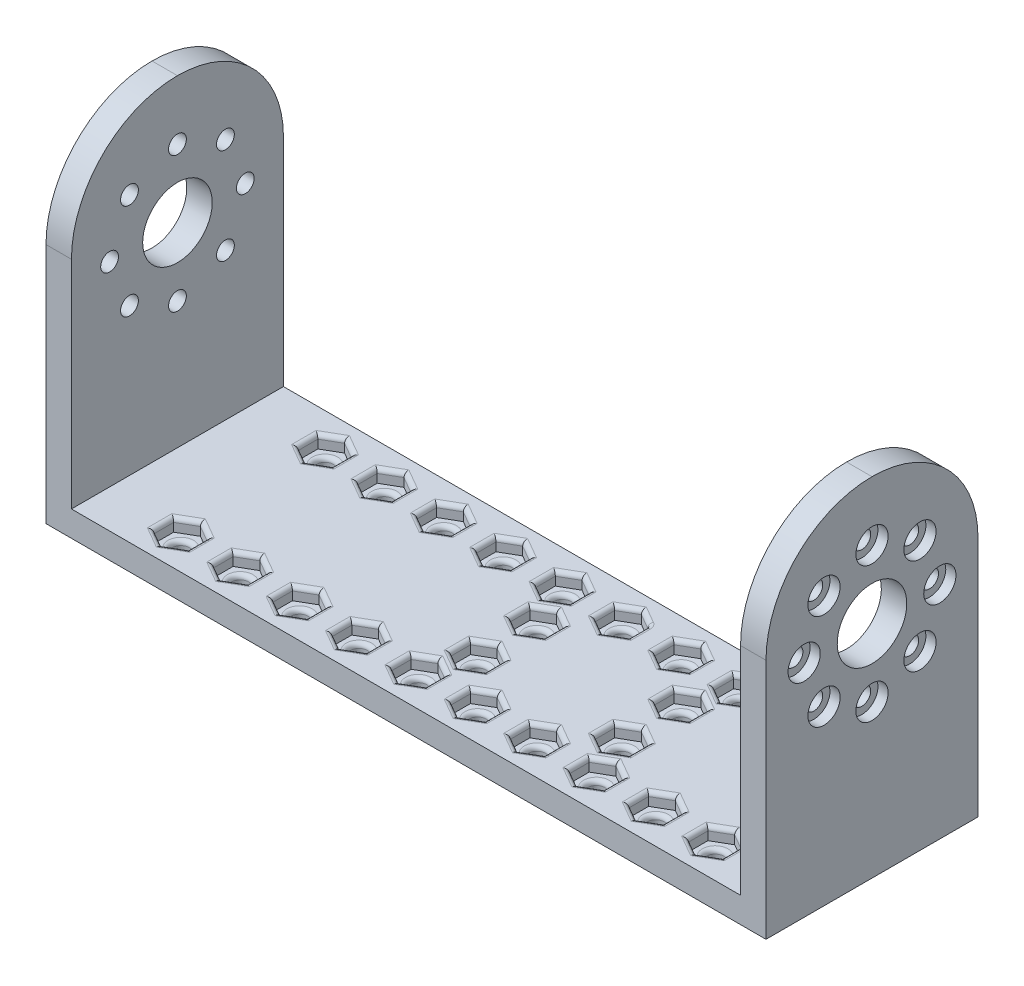
from build123d import *

# Parameters (mm, degrees)
BOSS_EXTRUDE1_DEPTH      = 25
SKETCH2_R                = 4.1
CUT_EXTRUDE1_DEPTH       = 3
SKETCH3_R                = 1.05
CUT_EXTRUDE2_DEPTH       = 81.9
SKETCH4_R                = 1.9
CUT_EXTRUDE3_DEPTH       = 1.2
CIRPATTERN1_COUNT        = 8
MIRROR2_COPY_1_SKETCH_R  = 1.05
MIRROR2_COPY_1_DEPTH     = 81.9
MIRROR2_COPY_2_SKETCH_R  = 1.05
MIRROR2_COPY_2_DEPTH     = 81.9
MIRROR2_COPY_3_SKETCH_R  = 1.05
MIRROR2_COPY_3_DEPTH     = 81.9
MIRROR2_COPY_4_SKETCH_R  = 1.05
MIRROR2_COPY_4_DEPTH     = 81.9
MIRROR2_COPY_5_SKETCH_R  = 1.05
MIRROR2_COPY_5_DEPTH     = 81.9
MIRROR2_COPY_6_SKETCH_R  = 1.05
MIRROR2_COPY_6_DEPTH     = 81.9
MIRROR2_COPY_7_SKETCH_R  = 1.05
MIRROR2_COPY_7_DEPTH     = 81.9
MIRROR2_COPY_8_SKETCH_R  = 1.9
MIRROR2_COPY_8_DEPTH     = 1.2
MIRROR2_COPY_9_SKETCH_R  = 1.9
MIRROR2_COPY_9_DEPTH     = 1.2
MIRROR2_COPY_10_SKETCH_R = 1.9
MIRROR2_COPY_10_DEPTH    = 1.2
MIRROR2_COPY_11_SKETCH_R = 1.9
MIRROR2_COPY_11_DEPTH    = 1.2
MIRROR2_COPY_12_SKETCH_R = 1.9
MIRROR2_COPY_12_DEPTH    = 1.2
MIRROR2_COPY_13_SKETCH_R = 1.9
MIRROR2_COPY_13_DEPTH    = 1.2
MIRROR2_COPY_14_SKETCH_R = 1.9
MIRROR2_COPY_14_DEPTH    = 1.2
CONG_1_R                 = 12.5
ESQUISSE1_R              = 1
ENL_V_MAT_EXTRU_1_DEPTH  = 10
CUT_EXTRUDE4_DEPTH       = 1.5
FILLET1_R                = 0.5


with BuildPart() as part:
    # Sketch1 → Boss-Extrude1 (new body)
    with BuildSketch(Plane.XY):
        Polygon((0, 0), (-42.45, 0), (-42.45, 41), (-39.45, 41), (-39.45, 3), (0, 3), align=None)
    boss_extrude1 = extrude(amount=BOSS_EXTRUDE1_DEPTH)

    # Sketch2 → Cut-Extrude1 (cut)
    with BuildSketch(Plane.ZY.offset(42.45)):
        with Locations((12.5, 26)):
            Circle(SKETCH2_R)
    cut_extrude1 = extrude(amount=-CUT_EXTRUDE1_DEPTH, mode=Mode.SUBTRACT)

    # Sketch3 → Cut-Extrude2 (cut)
    with BuildSketch(Plane.ZY.offset(42.45)):
        with Locations((12.5, 34)):
            Circle(SKETCH3_R)
    cut_extrude2 = extrude(amount=-CUT_EXTRUDE2_DEPTH, mode=Mode.SUBTRACT)

    # Sketch4 → Cut-Extrude3 (cut)
    with BuildSketch(Plane.ZY.offset(42.45)):
        with Locations((12.5, 34)):
            Circle(SKETCH4_R)
    cut_extrude3 = extrude(amount=-CUT_EXTRUDE3_DEPTH, mode=Mode.SUBTRACT)

    # CirPattern1: Cut-Extrude2, Cut-Extrude3 ×8 about axis
    cirpattern1_axis = Axis((0, 26, 12.5), (1, 0, 0))
    add([cut_extrude2.rotate(cirpattern1_axis, i * 360 / CIRPATTERN1_COUNT) for i in range(1, CIRPATTERN1_COUNT)], mode=Mode.SUBTRACT)
    add([cut_extrude3.rotate(cirpattern1_axis, i * 360 / CIRPATTERN1_COUNT) for i in range(1, CIRPATTERN1_COUNT)], mode=Mode.SUBTRACT)

    # Mirror2: Boss-Extrude1, Cut-Extrude1, Cut-Extrude2, Cut-Extrude3 across plane
    add(boss_extrude1.mirror(Plane(origin=(0, 3, 25), x_dir=(0, 0, 1), z_dir=(1, 0, 0))))
    add(cut_extrude1.mirror(Plane(origin=(0, 3, 25), x_dir=(0, 0, 1), z_dir=(1, 0, 0))), mode=Mode.SUBTRACT)
    add(cut_extrude2.mirror(Plane(origin=(0, 3, 25), x_dir=(0, 0, 1), z_dir=(1, 0, 0))), mode=Mode.SUBTRACT)
    add(cut_extrude3.mirror(Plane(origin=(0, 3, 25), x_dir=(0, 0, 1), z_dir=(1, 0, 0))), mode=Mode.SUBTRACT)

    # Mirror2 copy 1 sketch → Mirror2 copy 1 (cut)
    with BuildSketch(Plane(origin=(42.45, 16.454058454, -14.723611076), x_dir=(0, -0.7071067811865475, 0.7071067811865476), z_dir=(1, 0, 0))):
        with Locations((12.5, -34)):
            Circle(MIRROR2_COPY_1_SKETCH_R)
    extrude(amount=-MIRROR2_COPY_1_DEPTH, mode=Mode.SUBTRACT)

    # Mirror2 copy 2 sketch → Mirror2 copy 2 (cut)
    with BuildSketch(Plane(origin=(42.45, 38.5, -13.5), x_dir=(0, -1, 0), z_dir=(1, 0, 0))):
        with Locations((12.5, -34)):
            Circle(MIRROR2_COPY_2_SKETCH_R)
    extrude(amount=-MIRROR2_COPY_2_DEPTH, mode=Mode.SUBTRACT)

    # Mirror2 copy 3 sketch → Mirror2 copy 3 (cut)
    with BuildSketch(Plane(origin=(42.45, 53.223611076, 2.954058454), x_dir=(0, -0.7071067811865476, -0.7071067811865475), z_dir=(1, 0, 0))):
        with Locations((12.5, -34)):
            Circle(MIRROR2_COPY_3_SKETCH_R)
    extrude(amount=-MIRROR2_COPY_3_DEPTH, mode=Mode.SUBTRACT)

    # Mirror2 copy 4 sketch → Mirror2 copy 4 (cut)
    with BuildSketch(Plane(origin=(42.45, 52, 25), x_dir=(0, 0, -1), z_dir=(1, 0, 0))):
        with Locations((12.5, -34)):
            Circle(MIRROR2_COPY_4_SKETCH_R)
    extrude(amount=-MIRROR2_COPY_4_DEPTH, mode=Mode.SUBTRACT)

    # Mirror2 copy 5 sketch → Mirror2 copy 5 (cut)
    with BuildSketch(Plane(origin=(42.45, 35.545941546, 39.723611076), x_dir=(0, 0.7071067811865475, -0.7071067811865477), z_dir=(1, 0, 0))):
        with Locations((12.5, -34)):
            Circle(MIRROR2_COPY_5_SKETCH_R)
    extrude(amount=-MIRROR2_COPY_5_DEPTH, mode=Mode.SUBTRACT)

    # Mirror2 copy 6 sketch → Mirror2 copy 6 (cut)
    with BuildSketch(Plane(origin=(42.45, 13.5, 38.5), x_dir=(0, 1, 0), z_dir=(1, 0, 0))):
        with Locations((12.5, -34)):
            Circle(MIRROR2_COPY_6_SKETCH_R)
    extrude(amount=-MIRROR2_COPY_6_DEPTH, mode=Mode.SUBTRACT)

    # Mirror2 copy 7 sketch → Mirror2 copy 7 (cut)
    with BuildSketch(Plane(origin=(42.45, -1.223611076, 22.045941546), x_dir=(0, 0.7071067811865477, 0.7071067811865474), z_dir=(1, 0, 0))):
        with Locations((12.5, -34)):
            Circle(MIRROR2_COPY_7_SKETCH_R)
    extrude(amount=-MIRROR2_COPY_7_DEPTH, mode=Mode.SUBTRACT)

    # Mirror2 copy 8 sketch → Mirror2 copy 8 (cut)
    with BuildSketch(Plane(origin=(42.45, 16.454058454, -14.723611076), x_dir=(0, -0.7071067811865475, 0.7071067811865476), z_dir=(1, 0, 0))):
        with Locations((12.5, -34)):
            Circle(MIRROR2_COPY_8_SKETCH_R)
    extrude(amount=-MIRROR2_COPY_8_DEPTH, mode=Mode.SUBTRACT)

    # Mirror2 copy 9 sketch → Mirror2 copy 9 (cut)
    with BuildSketch(Plane(origin=(42.45, 38.5, -13.5), x_dir=(0, -1, 0), z_dir=(1, 0, 0))):
        with Locations((12.5, -34)):
            Circle(MIRROR2_COPY_9_SKETCH_R)
    extrude(amount=-MIRROR2_COPY_9_DEPTH, mode=Mode.SUBTRACT)

    # Mirror2 copy 10 sketch → Mirror2 copy 10 (cut)
    with BuildSketch(Plane(origin=(42.45, 53.223611076, 2.954058454), x_dir=(0, -0.7071067811865476, -0.7071067811865475), z_dir=(1, 0, 0))):
        with Locations((12.5, -34)):
            Circle(MIRROR2_COPY_10_SKETCH_R)
    extrude(amount=-MIRROR2_COPY_10_DEPTH, mode=Mode.SUBTRACT)

    # Mirror2 copy 11 sketch → Mirror2 copy 11 (cut)
    with BuildSketch(Plane(origin=(42.45, 52, 25), x_dir=(0, 0, -1), z_dir=(1, 0, 0))):
        with Locations((12.5, -34)):
            Circle(MIRROR2_COPY_11_SKETCH_R)
    extrude(amount=-MIRROR2_COPY_11_DEPTH, mode=Mode.SUBTRACT)

    # Mirror2 copy 12 sketch → Mirror2 copy 12 (cut)
    with BuildSketch(Plane(origin=(42.45, 35.545941546, 39.723611076), x_dir=(0, 0.7071067811865475, -0.7071067811865477), z_dir=(1, 0, 0))):
        with Locations((12.5, -34)):
            Circle(MIRROR2_COPY_12_SKETCH_R)
    extrude(amount=-MIRROR2_COPY_12_DEPTH, mode=Mode.SUBTRACT)

    # Mirror2 copy 13 sketch → Mirror2 copy 13 (cut)
    with BuildSketch(Plane(origin=(42.45, 13.5, 38.5), x_dir=(0, 1, 0), z_dir=(1, 0, 0))):
        with Locations((12.5, -34)):
            Circle(MIRROR2_COPY_13_SKETCH_R)
    extrude(amount=-MIRROR2_COPY_13_DEPTH, mode=Mode.SUBTRACT)

    # Mirror2 copy 14 sketch → Mirror2 copy 14 (cut)
    with BuildSketch(Plane(origin=(42.45, -1.223611076, 22.045941546), x_dir=(0, 0.7071067811865477, 0.7071067811865474), z_dir=(1, 0, 0))):
        with Locations((12.5, -34)):
            Circle(MIRROR2_COPY_14_SKETCH_R)
    extrude(amount=-MIRROR2_COPY_14_DEPTH, mode=Mode.SUBTRACT)

    # Congé1
    cong_1_edges = [part.edges().sort_by_distance(p)[0] for p in [
        (-40.95, 41, 0),
        (-40.95, 41, 25),
        (40.95, 41, 0),
        (40.95, 41, 25),
    ]]
    fillet(cong_1_edges, radius=CONG_1_R - 0.0001)  # a hair under: the kernel refuses the full size

    # Esquisse1 → Enlèv. mat.-Extru.1 (cut)
    with BuildSketch(Plane(origin=(0, 3, 0), x_dir=(1, 0, 0), z_dir=(0, 1, 0))):
        with Locations(Location((4.45, -4, 0), (0, 0, 270))):
            Circle(ESQUISSE1_R)
        with Locations(Location((-0.55, -9, 0), (0, 0, 270))):
            Circle(ESQUISSE1_R)
        with Locations(Location((-0.55, -16, 0), (0, 0, 270))):
            Circle(ESQUISSE1_R)
        with Locations(Location((4.45, -21, 0), (0, 0, 270))):
            Circle(ESQUISSE1_R)
        with Locations(Location((11.45, -21, 0), (0, 0, 270))):
            Circle(ESQUISSE1_R)
        with Locations(Location((16.45, -16, 0), (0, 0, 270))):
            Circle(ESQUISSE1_R)
        with Locations(Location((16.45, -9, 0), (0, 0, 270))):
            Circle(ESQUISSE1_R)
        with Locations(Location((11.45, -4, 0), (0, 0, 270))):
            Circle(ESQUISSE1_R)
        with Locations(Location((-2.55, -4, 0), (0, 0, 270))):
            Circle(ESQUISSE1_R)
        with Locations(Location((-2.55, -21, 0), (0, 0, 270))):
            Circle(ESQUISSE1_R)
        with Locations(Location((-9.55, -4, 0), (0, 0, 270))):
            Circle(ESQUISSE1_R)
        with Locations(Location((-9.55, -21, 0), (0, 0, 270))):
            Circle(ESQUISSE1_R)
        with Locations(Location((-16.55, -4, 0), (0, 0, 270))):
            Circle(ESQUISSE1_R)
        with Locations(Location((-16.55, -21, 0), (0, 0, 270))):
            Circle(ESQUISSE1_R)
        with Locations(Location((-23.55, -4, 0), (0, 0, 270))):
            Circle(ESQUISSE1_R)
        with Locations(Location((-23.55, -21, 0), (0, 0, 270))):
            Circle(ESQUISSE1_R)
        with Locations(Location((-30.55, -4, 0), (0, 0, 270))):
            Circle(ESQUISSE1_R)
        with Locations(Location((-30.55, -21, 0), (0, 0, 270))):
            Circle(ESQUISSE1_R)
        with Locations(Location((18.45, -4, 0), (0, 0, 270))):
            Circle(ESQUISSE1_R)
        with Locations(Location((18.45, -21, 0), (0, 0, 270))):
            Circle(ESQUISSE1_R)
        with Locations(Location((25.45, -4, 0), (0, 0, 270))):
            Circle(ESQUISSE1_R)
        with Locations(Location((25.45, -21, 0), (0, 0, 270))):
            Circle(ESQUISSE1_R)
        with Locations(Location((32.45, -4, 0), (0, 0, 270))):
            Circle(ESQUISSE1_R)
        with Locations(Location((32.45, -21, 0), (0, 0, 270))):
            Circle(ESQUISSE1_R)
    extrude(amount=-ENL_V_MAT_EXTRU_1_DEPTH, mode=Mode.SUBTRACT)

    # Sketch5 → Cut-Extrude4 (cut)
    with BuildSketch(Plane(origin=(0, 3, 0), x_dir=(1, 0, 0), z_dir=(0, 1, 0))):
        Polygon((11.45, -6.309401077), (13.45, -5.154700538), (13.45, -2.845299462), (11.45, -1.690598923), (9.45, -2.845299462), (9.45, -5.154700538), align=None)
        Polygon((4.45, -6.309401077), (6.45, -5.154700538), (6.45, -2.845299462), (4.45, -1.690598923), (2.45, -2.845299462), (2.45, -5.154700538), align=None)
        Polygon((-0.55, -11.309401077), (1.45, -10.154700538), (1.45, -7.845299462), (-0.55, -6.690598923), (-2.55, -7.845299462), (-2.55, -10.154700538), align=None)
        Polygon((-0.55, -18.309401077), (1.45, -17.154700538), (1.45, -14.845299462), (-0.55, -13.690598923), (-2.55, -14.845299462), (-2.55, -17.154700538), align=None)
        Polygon((4.45, -23.309401077), (6.45, -22.154700538), (6.45, -19.845299462), (4.45, -18.690598923), (2.45, -19.845299462), (2.45, -22.154700538), align=None)
        Polygon((11.45, -23.309401077), (13.45, -22.154700538), (13.45, -19.845299462), (11.45, -18.690598923), (9.45, -19.845299462), (9.45, -22.154700538), align=None)
        Polygon((16.45, -18.309401077), (18.45, -17.154700538), (18.45, -14.845299462), (16.45, -13.690598923), (14.45, -14.845299462), (14.45, -17.154700538), align=None)
        Polygon((16.45, -11.309401077), (18.45, -10.154700538), (18.45, -7.845299462), (16.45, -6.690598923), (14.45, -7.845299462), (14.45, -10.154700538), align=None)
        Polygon((-2.55, -1.690598923), (-4.55, -2.845299462), (-4.55, -5.154700538), (-2.55, -6.309401077), (-0.55, -5.154700538), (-0.55, -2.845299462), align=None)
        Polygon((-9.55, -1.690598923), (-11.55, -2.845299462), (-11.55, -5.154700538), (-9.55, -6.309401077), (-7.55, -5.154700538), (-7.55, -2.845299462), align=None)
        Polygon((-16.55, -1.690598923), (-18.55, -2.845299462), (-18.55, -5.154700538), (-16.55, -6.309401077), (-14.55, -5.154700538), (-14.55, -2.845299462), align=None)
        Polygon((-23.55, -1.690598923), (-25.55, -2.845299462), (-25.55, -5.154700538), (-23.55, -6.309401077), (-21.55, -5.154700538), (-21.55, -2.845299462), align=None)
        Polygon((-30.55, -1.690598923), (-32.55, -2.845299462), (-32.55, -5.154700538), (-30.55, -6.309401077), (-28.55, -5.154700538), (-28.55, -2.845299462), align=None)
        Polygon((-30.55, -18.690598923), (-32.55, -19.845299462), (-32.55, -22.154700538), (-30.55, -23.309401077), (-28.55, -22.154700538), (-28.55, -19.845299462), align=None)
        Polygon((-23.55, -18.690598923), (-25.55, -19.845299462), (-25.55, -22.154700538), (-23.55, -23.309401077), (-21.55, -22.154700538), (-21.55, -19.845299462), align=None)
        Polygon((-16.55, -18.690598923), (-18.55, -19.845299462), (-18.55, -22.154700538), (-16.55, -23.309401077), (-14.55, -22.154700538), (-14.55, -19.845299462), align=None)
        Polygon((-9.55, -18.690598923), (-11.55, -19.845299462), (-11.55, -22.154700538), (-9.55, -23.309401077), (-7.55, -22.154700538), (-7.55, -19.845299462), align=None)
        Polygon((-2.55, -18.690598923), (-4.55, -19.845299462), (-4.55, -22.154700538), (-2.55, -23.309401077), (-0.55, -22.154700538), (-0.55, -19.845299462), align=None)
        Polygon((18.45, -18.690598923), (16.45, -19.845299462), (16.45, -22.154700538), (18.45, -23.309401077), (20.45, -22.154700538), (20.45, -19.845299462), align=None)
        Polygon((25.45, -18.690598923), (23.45, -19.845299462), (23.45, -22.154700538), (25.45, -23.309401077), (27.45, -22.154700538), (27.45, -19.845299462), align=None)
        Polygon((32.45, -18.690598923), (30.45, -19.845299462), (30.45, -22.154700538), (32.45, -23.309401077), (34.45, -22.154700538), (34.45, -19.845299462), align=None)
        Polygon((18.45, -1.690598923), (16.45, -2.845299462), (16.45, -5.154700538), (18.45, -6.309401077), (20.45, -5.154700538), (20.45, -2.845299462), align=None)
        Polygon((25.45, -1.690598923), (23.45, -2.845299462), (23.45, -5.154700538), (25.45, -6.309401077), (27.45, -5.154700538), (27.45, -2.845299462), align=None)
        Polygon((32.45, -1.690598923), (30.45, -2.845299462), (30.45, -5.154700538), (32.45, -6.309401077), (34.45, -5.154700538), (34.45, -2.845299462), align=None)
    extrude(amount=-CUT_EXTRUDE4_DEPTH, mode=Mode.SUBTRACT)

    # Fillet1
    fillet1_edges = [part.edges().sort_by_distance(p)[0] for p in [
        (10.45, 3, 5.732050808),
        (12.45, 3, 5.732050808),
        (13.45, 3, 4),
        (12.45, 3, 2.267949192),
        (10.45, 3, 2.267949192),
        (9.45, 3, 4),
        (11.45, 1.5, 3),
        (3.45, 3, 5.732050808),
        (5.45, 3, 5.732050808),
        (6.45, 3, 4),
        (5.45, 3, 2.267949192),
        (3.45, 3, 2.267949192),
        (2.45, 3, 4),
        (6.45, 2.25, 2.845299462),
        (4.45, 1.5, 3),
        (-1.55, 3, 10.732050808),
        (0.45, 3, 10.732050808),
        (1.45, 3, 9),
        (0.45, 3, 7.267949192),
        (-1.55, 3, 7.267949192),
        (-2.55, 3, 9),
        (-0.55, 1.5, 8),
        (-1.55, 3, 17.732050808),
        (0.45, 3, 17.732050808),
        (1.45, 3, 16),
        (0.45, 3, 14.267949192),
        (-1.55, 3, 14.267949192),
        (-2.55, 3, 16),
        (-0.55, 1.5, 15),
        (3.45, 3, 22.732050808),
        (5.45, 3, 22.732050808),
        (6.45, 3, 21),
        (5.45, 3, 19.267949192),
        (3.45, 3, 19.267949192),
        (2.45, 3, 21),
        (4.45, 1.5, 20),
        (10.45, 3, 22.732050808),
        (12.45, 3, 22.732050808),
        (13.45, 3, 21),
        (12.45, 3, 19.267949192),
        (10.45, 3, 19.267949192),
        (9.45, 3, 21),
        (11.45, 1.5, 20),
        (15.45, 3, 17.732050808),
        (17.45, 3, 17.732050808),
        (18.45, 3, 16),
        (17.45, 3, 14.267949192),
        (15.45, 3, 14.267949192),
        (14.45, 3, 16),
        (16.45, 1.5, 15),
        (15.45, 3, 10.732050808),
        (17.45, 3, 10.732050808),
        (18.45, 3, 9),
        (17.45, 3, 7.267949192),
        (15.45, 3, 7.267949192),
        (14.45, 3, 9),
        (16.45, 1.5, 8),
        (-1.55, 3, 2.267949192),
        (-3.55, 3, 2.267949192),
        (-4.55, 3, 4),
        (-3.55, 3, 5.732050808),
        (-1.55, 3, 5.732050808),
        (-0.55, 3, 4),
        (-2.55, 1.5, 3),
        (-8.55, 3, 2.267949192),
        (-10.55, 3, 2.267949192),
        (-11.55, 3, 4),
        (-10.55, 3, 5.732050808),
        (-8.55, 3, 5.732050808),
        (-7.55, 3, 4),
        (-9.55, 1.5, 3),
        (-15.55, 3, 2.267949192),
        (-17.55, 3, 2.267949192),
        (-18.55, 3, 4),
        (-17.55, 3, 5.732050808),
        (-15.55, 3, 5.732050808),
        (-14.55, 3, 4),
        (-16.55, 1.5, 3),
        (-22.55, 3, 2.267949192),
        (-24.55, 3, 2.267949192),
        (-25.55, 3, 4),
        (-24.55, 3, 5.732050808),
        (-22.55, 3, 5.732050808),
        (-21.55, 3, 4),
        (-23.55, 1.5, 3),
        (-29.55, 3, 2.267949192),
        (-31.55, 3, 2.267949192),
        (-32.55, 3, 4),
        (-31.55, 3, 5.732050808),
        (-29.55, 3, 5.732050808),
        (-28.55, 3, 4),
        (-30.55, 1.5, 3),
        (-29.55, 3, 19.267949192),
        (-31.55, 3, 19.267949192),
        (-32.55, 3, 21),
        (-31.55, 3, 22.732050808),
        (-29.55, 3, 22.732050808),
        (-28.55, 3, 21),
        (-30.55, 1.5, 20),
        (-22.55, 3, 19.267949192),
        (-24.55, 3, 19.267949192),
        (-25.55, 3, 21),
        (-24.55, 3, 22.732050808),
        (-22.55, 3, 22.732050808),
        (-21.55, 3, 21),
        (-23.55, 1.5, 20),
        (-15.55, 3, 19.267949192),
        (-17.55, 3, 19.267949192),
        (-18.55, 3, 21),
        (-17.55, 3, 22.732050808),
        (-15.55, 3, 22.732050808),
        (-14.55, 3, 21),
        (-16.55, 1.5, 20),
        (-8.55, 3, 19.267949192),
        (-10.55, 3, 19.267949192),
        (-11.55, 3, 21),
        (-10.55, 3, 22.732050808),
        (-8.55, 3, 22.732050808),
        (-7.55, 3, 21),
        (-9.55, 1.5, 20),
        (-1.55, 3, 19.267949192),
        (-3.55, 3, 19.267949192),
        (-4.55, 3, 21),
        (-3.55, 3, 22.732050808),
        (-1.55, 3, 22.732050808),
        (-0.55, 3, 21),
        (-2.55, 1.5, 20),
        (19.45, 3, 19.267949192),
        (17.45, 3, 19.267949192),
        (16.45, 3, 21),
        (17.45, 3, 22.732050808),
        (19.45, 3, 22.732050808),
        (20.45, 3, 21),
        (18.45, 1.5, 20),
        (26.45, 3, 19.267949192),
        (24.45, 3, 19.267949192),
        (23.45, 3, 21),
        (24.45, 3, 22.732050808),
        (26.45, 3, 22.732050808),
        (27.45, 3, 21),
        (25.45, 1.5, 20),
        (33.45, 3, 19.267949192),
        (31.45, 3, 19.267949192),
        (30.45, 3, 21),
        (31.45, 3, 22.732050808),
        (33.45, 3, 22.732050808),
        (34.45, 3, 21),
        (32.45, 1.5, 20),
        (19.45, 3, 2.267949192),
        (17.45, 3, 2.267949192),
        (16.45, 3, 4),
        (17.45, 3, 5.732050808),
        (19.45, 3, 5.732050808),
        (20.45, 3, 4),
        (18.45, 1.5, 3),
        (26.45, 3, 2.267949192),
        (24.45, 3, 2.267949192),
        (23.45, 3, 4),
        (24.45, 3, 5.732050808),
        (26.45, 3, 5.732050808),
        (27.45, 3, 4),
        (25.45, 1.5, 3),
        (33.45, 3, 2.267949192),
        (31.45, 3, 2.267949192),
        (30.45, 3, 4),
        (31.45, 3, 5.732050808),
        (33.45, 3, 5.732050808),
        (34.45, 3, 4),
        (32.45, 1.5, 3),
    ]]
    fillet(fillet1_edges, radius=FILLET1_R)


solid = part.part
